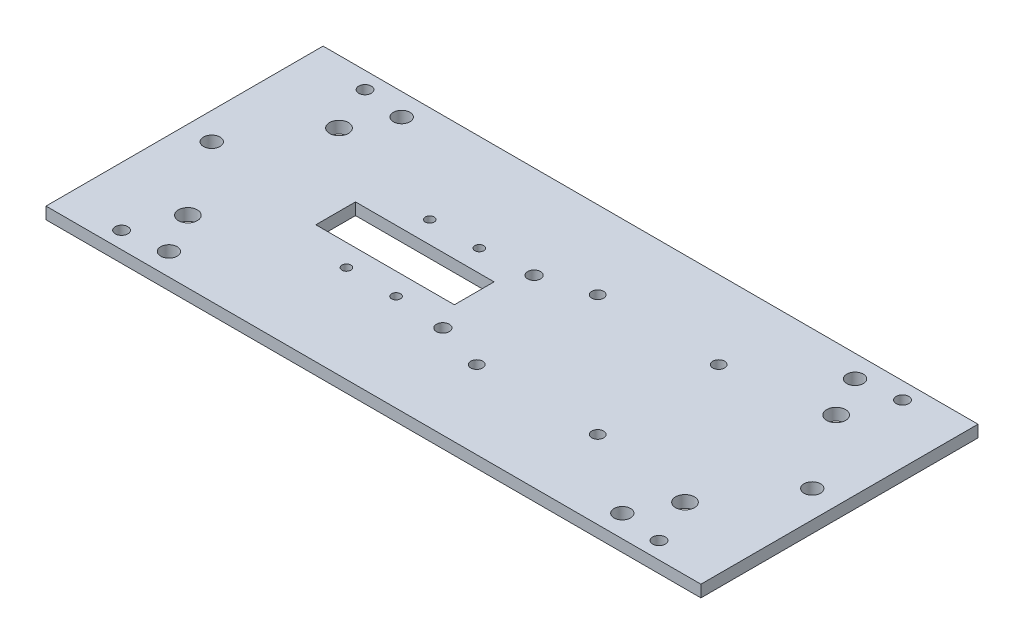
from build123d import *

# Parameters (mm, degrees)
SKETCH1_W           = 165.1
SKETCH1_H           = 69.85
BOSS_EXTRUDE1_DEPTH = 3
CUT_EXTRUDE1_REACH  = 91.684
SKETCH6_W           = 34.925
SKETCH6_H           = 10
SKETCH6_R           = 1.5
SKETCH6_R_2         = 1.625
CUT_EXTRUDE3_REACH  = 91.684
SKETCH8_R           = 2.38125
SKETCH9_R           = 2.0828
CUT_EXTRUDE5_DEPTH  = 5.08
SKETCH10_R          = 2.0828
CUT_EXTRUDE6_DEPTH  = 5.08
SKETCH11_R          = 1.125
SKETCH11_R_2        = 1.125000036
CUT_EXTRUDE7_DEPTH  = 41.91
SKETCH13_R          = 1.5875
CUT_EXTRUDE9_DEPTH  = 5


with BuildPart() as part:
    # Sketch1 → Boss-Extrude1 (new body)
    with BuildSketch(Plane(origin=(0, 0, 0), x_dir=(1, 0, 0), z_dir=(0, 1, 0))):
        Rectangle(SKETCH1_W, SKETCH1_H)
    extrude(amount=BOSS_EXTRUDE1_DEPTH)

    # Sketch6 → Cut-Extrude1 (cut, up to next)
    with BuildSketch(Plane.XZ, mode=Mode.PRIVATE) as cut_extrude1_sk1:
        with Locations((-26.9875, 0)):
            Rectangle(SKETCH6_W, SKETCH6_H)
    cut_extrude1_tool1 = extrude(cut_extrude1_sk1.sketch, amount=-CUT_EXTRUDE1_REACH, mode=Mode.PRIVATE) & part.part
    # Sketch6 → Cut-Extrude1 (cut, up to next)
    with BuildSketch(Plane.XZ, mode=Mode.PRIVATE) as cut_extrude1_sk2:
        with Locations((6.35, 15.25)):
            Circle(SKETCH6_R)
    cut_extrude1_tool2 = extrude(cut_extrude1_sk2.sketch, amount=-CUT_EXTRUDE1_REACH, mode=Mode.PRIVATE) & part.part
    # Sketch6 → Cut-Extrude1 (cut, up to next)
    with BuildSketch(Plane.XZ, mode=Mode.PRIVATE) as cut_extrude1_sk3:
        with Locations((36.85, 15.25)):
            Circle(SKETCH6_R)
    cut_extrude1_tool3 = extrude(cut_extrude1_sk3.sketch, amount=-CUT_EXTRUDE1_REACH, mode=Mode.PRIVATE) & part.part
    # Sketch6 → Cut-Extrude1 (cut, up to next)
    with BuildSketch(Plane.XZ, mode=Mode.PRIVATE) as cut_extrude1_sk4:
        with Locations((6.35, -15.25)):
            Circle(SKETCH6_R)
    cut_extrude1_tool4 = extrude(cut_extrude1_sk4.sketch, amount=-CUT_EXTRUDE1_REACH, mode=Mode.PRIVATE) & part.part
    # Sketch6 → Cut-Extrude1 (cut, up to next)
    with BuildSketch(Plane.XZ, mode=Mode.PRIVATE) as cut_extrude1_sk5:
        with Locations((36.85, -15.25)):
            Circle(SKETCH6_R)
    cut_extrude1_tool5 = extrude(cut_extrude1_sk5.sketch, amount=-CUT_EXTRUDE1_REACH, mode=Mode.PRIVATE) & part.part
    # Sketch6 → Cut-Extrude1 (cut, up to next)
    with BuildSketch(Plane.XZ, mode=Mode.PRIVATE) as cut_extrude1_sk6:
        with Locations((-5.924999961, 11.500993)):
            Circle(SKETCH6_R_2)
    cut_extrude1_tool6 = extrude(cut_extrude1_sk6.sketch, amount=-CUT_EXTRUDE1_REACH, mode=Mode.PRIVATE) & part.part
    # Sketch6 → Cut-Extrude1 (cut, up to next)
    with BuildSketch(Plane.XZ, mode=Mode.PRIVATE) as cut_extrude1_sk7:
        with Locations((-5.924999961, -11.500993)):
            Circle(SKETCH6_R_2)
    cut_extrude1_tool7 = extrude(cut_extrude1_sk7.sketch, amount=-CUT_EXTRUDE1_REACH, mode=Mode.PRIVATE) & part.part
    add(cut_extrude1_tool1.solids().sort_by_distance((-26.9875, 0, 0))[0], mode=Mode.SUBTRACT)
    add(cut_extrude1_tool2.solids().sort_by_distance((6.35, 0, 15.25))[0], mode=Mode.SUBTRACT)
    add(cut_extrude1_tool3.solids().sort_by_distance((36.85, 0, 15.25))[0], mode=Mode.SUBTRACT)
    add(cut_extrude1_tool4.solids().sort_by_distance((6.35, 0, -15.25))[0], mode=Mode.SUBTRACT)
    add(cut_extrude1_tool5.solids().sort_by_distance((36.85, 0, -15.25))[0], mode=Mode.SUBTRACT)
    add(cut_extrude1_tool6.solids().sort_by_distance((-5.925, 0, 11.500993))[0], mode=Mode.SUBTRACT)
    add(cut_extrude1_tool7.solids().sort_by_distance((-5.925, 0, -11.500993))[0], mode=Mode.SUBTRACT)

    # Sketch8 → Cut-Extrude3 (cut, up to next)
    with BuildSketch(Plane(origin=(0, 3, 0), x_dir=(1, 0, 0), z_dir=(0, 1, 0)), mode=Mode.PRIVATE) as cut_extrude3_sk1:
        with Locations((-62.6618, -19.05)):
            Circle(SKETCH8_R)
    cut_extrude3_tool1 = extrude(cut_extrude3_sk1.sketch, amount=-CUT_EXTRUDE3_REACH, mode=Mode.PRIVATE) & part.part
    # Sketch8 → Cut-Extrude3 (cut, up to next)
    with BuildSketch(Plane(origin=(0, 3, 0), x_dir=(1, 0, 0), z_dir=(0, 1, 0)), mode=Mode.PRIVATE) as cut_extrude3_sk2:
        with Locations((-62.6618, 19.05)):
            Circle(SKETCH8_R)
    cut_extrude3_tool2 = extrude(cut_extrude3_sk2.sketch, amount=-CUT_EXTRUDE3_REACH, mode=Mode.PRIVATE) & part.part
    # Sketch8 → Cut-Extrude3 (cut, up to next)
    with BuildSketch(Plane(origin=(0, 3, 0), x_dir=(1, 0, 0), z_dir=(0, 1, 0)), mode=Mode.PRIVATE) as cut_extrude3_sk3:
        with Locations((62.6618, 19.05)):
            Circle(SKETCH8_R)
    cut_extrude3_tool3 = extrude(cut_extrude3_sk3.sketch, amount=-CUT_EXTRUDE3_REACH, mode=Mode.PRIVATE) & part.part
    # Sketch8 → Cut-Extrude3 (cut, up to next)
    with BuildSketch(Plane(origin=(0, 3, 0), x_dir=(1, 0, 0), z_dir=(0, 1, 0)), mode=Mode.PRIVATE) as cut_extrude3_sk4:
        with Locations((62.6618, -19.05)):
            Circle(SKETCH8_R)
    cut_extrude3_tool4 = extrude(cut_extrude3_sk4.sketch, amount=-CUT_EXTRUDE3_REACH, mode=Mode.PRIVATE) & part.part
    add(cut_extrude3_tool1.solids().sort_by_distance((-62.6618, 3, 19.05))[0], mode=Mode.SUBTRACT)
    add(cut_extrude3_tool2.solids().sort_by_distance((-62.6618, 3, -19.05))[0], mode=Mode.SUBTRACT)
    add(cut_extrude3_tool3.solids().sort_by_distance((62.6618, 3, -19.05))[0], mode=Mode.SUBTRACT)
    add(cut_extrude3_tool4.solids().sort_by_distance((62.6618, 3, 19.05))[0], mode=Mode.SUBTRACT)

    # Sketch9 → Cut-Extrude5 (cut)
    with BuildSketch(Plane(origin=(0, 3, 0), x_dir=(1, 0, 0), z_dir=(0, 1, 0))):
        with Locations((-75.692, 0)):
            Circle(SKETCH9_R)
        with Locations((75.692, 0)):
            Circle(SKETCH9_R)
    extrude(amount=-CUT_EXTRUDE5_DEPTH, mode=Mode.SUBTRACT)

    # Sketch10 → Cut-Extrude6 (cut)
    with BuildSketch(Plane(origin=(0, 3, 0), x_dir=(1, 0, 0), z_dir=(0, 1, 0))):
        with Locations((57.15, -29.337)):
            Circle(SKETCH10_R)
        with Locations((57.15, 29.337)):
            Circle(SKETCH10_R)
        with Locations((-57.15, -29.337)):
            Circle(SKETCH10_R)
        with Locations((-57.15, 29.337)):
            Circle(SKETCH10_R)
    extrude(amount=-CUT_EXTRUDE6_DEPTH, mode=Mode.SUBTRACT)

    # Sketch11 → Cut-Extrude7 (cut)
    with BuildSketch(Plane(origin=(0, 3, 0), x_dir=(1, 0, 0), z_dir=(0, 1, 0))):
        with Locations((-31.2375, 10.5)):
            Circle(SKETCH11_R)
        with Locations((-18.7375, 10.5)):
            Circle(SKETCH11_R_2)
        with Locations((-18.7375, -10.5)):
            Circle(SKETCH11_R_2)
        with Locations((-31.2375, -10.5)):
            Circle(SKETCH11_R_2)
    extrude(amount=-CUT_EXTRUDE7_DEPTH, mode=Mode.SUBTRACT)

    # Sketch13 → Cut-Extrude9 (cut)
    with BuildSketch(Plane.XZ):
        with Locations((-67.742170098, 30.689580734)):
            Circle(SKETCH13_R)
        with Locations((67.742170098, 30.689580734)):
            Circle(SKETCH13_R)
        with Locations((67.742170098, -30.689580734)):
            Circle(SKETCH13_R)
        with Locations((-67.742170098, -30.689580734)):
            Circle(SKETCH13_R)
    extrude(amount=-CUT_EXTRUDE9_DEPTH, mode=Mode.SUBTRACT)


solid = part.part
